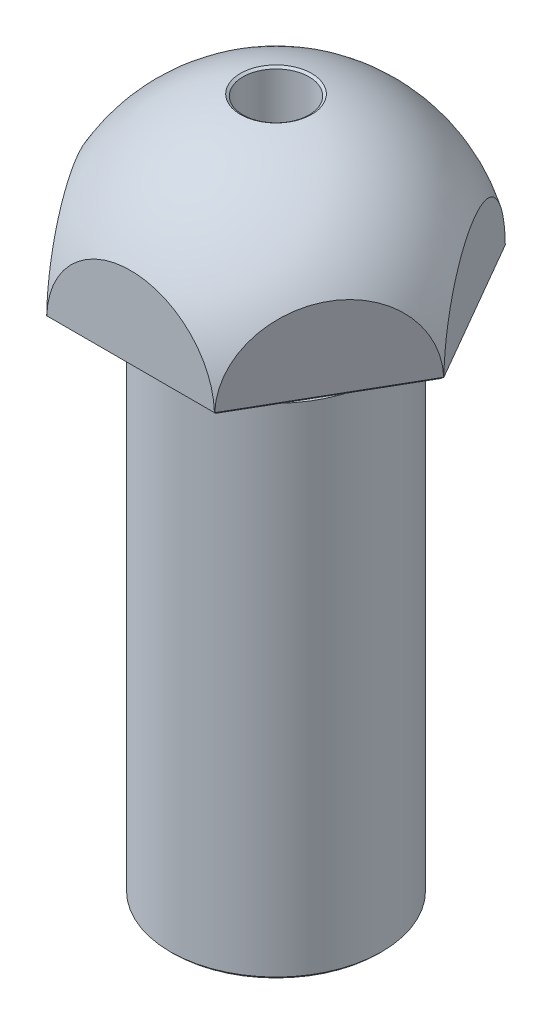
from build123d import *

# Parameters (mm, degrees)
SKETCH2_R             = 19.260759025
CUT_EXTRUDE1_DEPTH    = 50
M6X1_0_TAPPED_HOLE1_D = 5
CHAMFER1_SIZE         = 0.2
CHAMFER1_SIZE_2       = 0.169882553
BOSS_EXTRUDE1_START   = -27
SKETCH6_R             = 2.5
BOSS_EXTRUDE1_DEPTH   = 27


with BuildPart() as part:
    # Sketch3 → Revolve1 (revolve)
    with BuildSketch(Plane.XY, mode=Mode.PRIVATE) as revolve1_sk:
        with BuildLine():
            Line((0, 0), (8, 0))
            Line((8, 0), (8, 38))
            ThreePointArc((8, 38), (7, 39), (8, 40))
            Line((8, 40), (12.7, 40))
            ThreePointArc((12.7, 40), (8.980256121, 48.980256121), (0, 52.7))
            Line((0, 52.7), (0, 0))
        make_face()
    revolve(revolve1_sk.sketch.rotate(Axis((0, 0, 0), (0, 1, 0)), 90), axis=Axis((0, 0, 0), (0, 1, 0)))

    # Sketch2 → Cut-Extrude1 (cut)
    with BuildSketch(Plane(origin=(0, 0, 0), x_dir=(1, 0, 0), z_dir=(0, 1, 0))):
        Circle(SKETCH2_R)
        Polygon((-6.350852961, 11), (-12.701705922, 0), (-6.350852961, -11), (6.350852961, -11), (12.701705922, 0), (6.350852961, 11), align=None, mode=Mode.SUBTRACT)
    extrude(amount=CUT_EXTRUDE1_DEPTH, mode=Mode.SUBTRACT)

    # M6x1.0 Tapped Hole1 (through all)
    with Locations(Plane(origin=(0, 0, 0), x_dir=(-1, 0, 0), z_dir=(0, -1, 0))):
        with Locations((0, 0)):
            Hole(M6X1_0_TAPPED_HOLE1_D / 2)

    # Chamfer1
    # the kernel refuses this chamfer: 0.2, 0.169882553 mm, written as the material it takes off along each edge
    with BuildSketch(Plane(origin=(12.957167955, 40, 0.44247322), x_dir=(-0.8660254037844386, 0, 0.5), z_dir=(-0.5000000000000001, 0, -0.8660254037844387)), Plane(origin=(6.095390928, 40, 11.44247322), x_dir=(-0.8660254037844386, 0, -0.5), z_dir=(0.5000000000000001, 0, -0.8660254037844386)), Plane(origin=(-6.861777027, 40, 11), x_dir=(0, 0, -1), z_dir=(1, 0, 0)), Plane(origin=(-12.957167955, 40, -0.44247322), x_dir=(0.8660254037844387, 0, -0.5), z_dir=(0.5, 0, 0.8660254037844387)), Plane(origin=(-6.095390928, 40, -11.44247322), x_dir=(0.8660254037844384, 0, 0.5000000000000002), z_dir=(-0.5000000000000003, 0, 0.8660254037844386)), Plane(origin=(6.861777027, 40, -11), x_dir=(0, 0, 1), z_dir=(-1, 0, 0))) as chamfer1_piece_1:
        Polygon((CHAMFER1_SIZE, 0), (0, CHAMFER1_SIZE), (0, 0), align=None)
    extrude(amount=13.723554053, mode=Mode.SUBTRACT)
    with BuildSketch(Plane(origin=(0, 38, 0), x_dir=(0, 0, -1), z_dir=(1, 0, 0))) as chamfer1_piece_2:
        with BuildLine():
            Line((8, -CHAMFER1_SIZE), (7.774165739, 0.025834261))
            ThreePointArc((7.774165739, 0.025834261), (7.883207603, 0.00684365), (8, 0))
            Line((8, 0), (8, -CHAMFER1_SIZE))
        make_face()
    revolve(axis=Axis((0, 38, 0), (0, 1, 0)), mode=Mode.SUBTRACT)
    with BuildSketch(Plane(origin=(0, 0, 0), x_dir=(0, 0, -1), z_dir=(1, 0, 0))) as chamfer1_piece_3:
        Polygon((8 - CHAMFER1_SIZE, 0), (8, CHAMFER1_SIZE), (8, 0), align=None)
    revolve(axis=Axis((0, 0, 0), (0, 1, 0)), mode=Mode.SUBTRACT)
    with BuildSketch(Plane(origin=(0, 52.451505933, 0), x_dir=(1, 0, 0), z_dir=(0, 0, 1))) as chamfer1_piece_4:
        with BuildLine():
            Line((2.5, -CHAMFER1_SIZE_2), (2.694261242, -0.040585082))
            ThreePointArc((2.694261242, -0.040585082), (2.599956234, -0.020487166), (2.5, 0))
            Line((2.5, 0), (2.5, -CHAMFER1_SIZE_2))
        make_face()
    revolve(axis=Axis((0, 52.451505933, 0), (0, 1, 0)), revolution_arc=90, mode=Mode.SUBTRACT)
    with BuildSketch(Plane(origin=(0, 52.451505933, 0), x_dir=(0, 0, -1), z_dir=(1, 0, 0))) as chamfer1_piece_5:
        with BuildLine():
            Line((2.5, -CHAMFER1_SIZE_2), (2.694261242, -0.040585082))
            ThreePointArc((2.694261242, -0.040585082), (2.599956234, -0.020487166), (2.5, 0))
            Line((2.5, 0), (2.5, -CHAMFER1_SIZE_2))
        make_face()
    revolve(axis=Axis((0, 52.451505933, 0), (0, 1, 0)), revolution_arc=270, mode=Mode.SUBTRACT)

    # Sketch6 → Boss-Extrude1 (add)
    with BuildSketch(Plane.XZ.offset(BOSS_EXTRUDE1_START)):
        with Locations(Location((0, 0, 0), (0, 0, 270))):
            Circle(SKETCH6_R)
    extrude(amount=BOSS_EXTRUDE1_DEPTH)


solid = part.part
